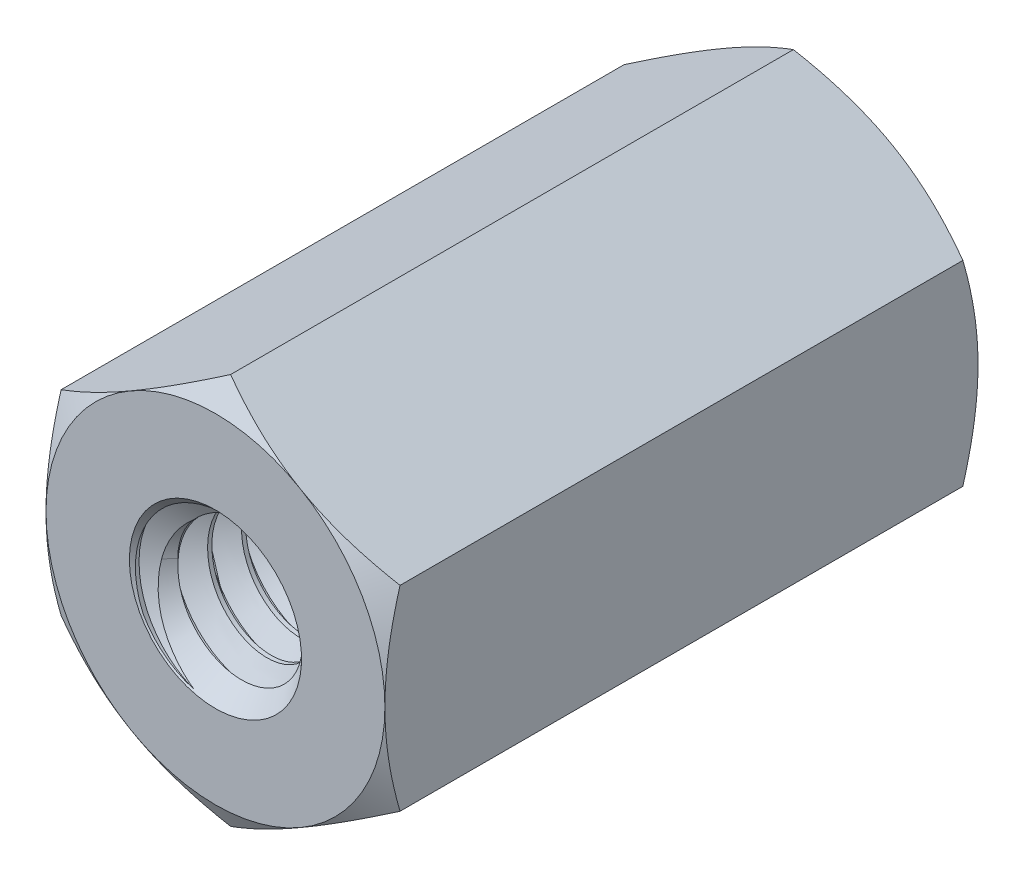
from build123d import *

# Parameters (mm, degrees)
EXTRUDE1_DEPTH          = 11.1125
EXTRUDE1_DEPTH_BACK     = 11.1125
SKETCH1_R               = 3.175
SWEEP1_PITCH            = 1.27
EXTRUDE2_DEPTH          = 26.41867433
SKETCH8_OUTSIDE_W       = 112.31
SKETCH8_OUTSIDE_H       = 114.274
SKETCH8_OUTSIDE_R       = 6.35
EXTRUDE4_DEPTH          = 26.41867433
EXTRUDE4_DRAFT          = -60
MIRROR1_COPY_1_SKETCH_W = 112.31
MIRROR1_COPY_1_SKETCH_H = 114.274
MIRROR1_COPY_1_SKETCH_R = 6.35
MIRROR1_COPY_1_DEPTH    = 26.41867433
MIRROR1_COPY_1_DRAFT    = -60


with BuildPart() as part:
    # Sketch1 → Extrude1 (new, two sides: drawn at the far end of the back side and taken through both)
    with BuildSketch(Plane.XY.offset(-EXTRUDE1_DEPTH_BACK)):
        Polygon((0, 7.332348419), (-6.35, 3.666174209), (-6.35, -3.666174209), (0, -7.332348419), (6.35, -3.666174209), (6.35, 3.666174209), align=None)
        Circle(SKETCH1_R, mode=Mode.SUBTRACT)
    extrude(amount=EXTRUDE1_DEPTH + EXTRUDE1_DEPTH_BACK)

    # Sweep1: the profile of Sketch12 profile screwed along a right-hand helix of 18.5 turns, 8 arcs to a turn; built about Z, then put on its axis
    sweep1_z = Axis((0, 0, 0), (0, 0, 1))
    sweep1_corners = [(3.1753, 0, -1.111423205), (3.1753, 0, 0.000173205), (2.350110803, 0, -0.47625), (2.350110803, 0, -0.635)]
    with BuildLine(mode=Mode.PRIVATE) as sweep1_profile:
        Line(sweep1_corners[0], sweep1_corners[1])
        Line(sweep1_corners[1], sweep1_corners[2])
        Line(sweep1_corners[2], sweep1_corners[3])
        Line(sweep1_corners[3], sweep1_corners[0])
    sweep1_cap = Face(sweep1_profile.wire())
    sweep1_turn_angles = [0, 22.5, 45, 67.5, 90, 112.5, 135, 157.5, 180, 202.5, 225, 247.5, 270, 292.5, 315, 337.5, 360]
    sweep1_turn_weights = [1, 0.9238795325112867, 1, 0.9238795325112867, 1, 0.9238795325112867, 1, 0.9238795325112867, 1, 0.9238795325112867, 1, 0.9238795325112867, 1, 0.9238795325112867, 1, 0.9238795325112867, 1]
    sweep1_turn_rails = [Edge.make_bspline([Vector(p[0], p[1], 0).rotate(sweep1_z, sweep1_turn_angles[k]) / sweep1_turn_weights[k] + Vector(0, 0, p[2] + SWEEP1_PITCH * sweep1_turn_angles[k] / 360) for k in range(17)], [0, 0, 0, 1, 1, 2, 2, 3, 3, 4, 4, 5, 5, 6, 6, 7, 7, 8, 8, 8], 2, sweep1_turn_weights) for p in sweep1_corners]
    sweep1_turn_sides = [Face.make_surface_from_curves(sweep1_turn_rails[p[0]], sweep1_turn_rails[p[1]]) for p in [(0, 1), (1, 2), (2, 3), (3, 0)]]
    sweep1_last_angles = [6480, 6502.5, 6525, 6547.5, 6570, 6592.5, 6615, 6637.5, 6660]
    sweep1_last_weights = [1, 0.9238795325112867, 1, 0.9238795325112867, 1, 0.9238795325112867, 1, 0.9238795325111926, 1]
    sweep1_last_rails = [Edge.make_bspline([Vector(p[0], p[1], 0).rotate(sweep1_z, sweep1_last_angles[k]) / sweep1_last_weights[k] + Vector(0, 0, p[2] + SWEEP1_PITCH * sweep1_last_angles[k] / 360) for k in range(9)], [0, 0, 0, 1, 1, 2, 2, 3, 3, 4, 4, 4], 2, sweep1_last_weights) for p in sweep1_corners]
    sweep1_last_sides = [Face.make_surface_from_curves(sweep1_last_rails[p[0]], sweep1_last_rails[p[1]]) for p in [(0, 1), (1, 2), (2, 3), (3, 0)]]
    sweep1 = Plane(origin=(0, 0, -11.1125), x_dir=(0, 1, 0), z_dir=(0, 0, 1)) * Solid(Shell([*[p.moved(Location((0, 0, SWEEP1_PITCH * i))) for i in range(18) for p in sweep1_turn_sides], *sweep1_last_sides, sweep1_cap, sweep1_cap.rotate(sweep1_z, 6660).moved(Location((0, 0, SWEEP1_PITCH * 6660 / 360)))]))
    add(sweep1)

    # Sketch6 → Extrude2 (cut, through all)
    with BuildSketch(Plane(origin=(0, 0, -11.1125), x_dir=(-1, 0, 0), z_dir=(0, 0, -1))):
        Polygon((0, 7.332348419), (-6.35, 3.666174209), (-6.35, -3.666174209), (0, -7.332348419), (6.35, -3.666174209), (6.35, 3.666174209), align=None)
    extrude2 = extrude(amount=EXTRUDE2_DEPTH, mode=Mode.SUBTRACT)

    # Extrude3 cone 1 section (through the dimple's axis) → Extrude3 (revolve, cut)
    with BuildSketch(Plane(origin=(0, 0, -11.1125), x_dir=(0, 1, 0), z_dir=(1, 0, 0))):
        Polygon((0, 0), (3.2258, 0), (0, 3.459246985), align=None)
    extrude3 = revolve(axis=Axis((0, 0, -11.1125), (0, 0, 1)), mode=Mode.SUBTRACT)


with BuildPart() as extrude4_tool:
    # Sketch8 outside → Extrude4 (with draft: the straight prism first)
    with BuildSketch(Plane(origin=(0, 0, -11.1125), x_dir=(-1, 0, 0), z_dir=(0, 0, -1))):
        Rectangle(SKETCH8_OUTSIDE_W, SKETCH8_OUTSIDE_H)
        Circle(SKETCH8_OUTSIDE_R, mode=Mode.SUBTRACT)
    extrude(amount=-EXTRUDE4_DEPTH)
    # Extrude4: the draft: its side faces are tilted about the plane it starts from
    extrude4_sides = [extrude4_tool.faces().sort_by_distance(p)[0] for p in [
        (0, -57.137, 2.096837165),
        (-56.155, 0, 2.096837165),
        (0, 57.137, 2.096837165),
        (56.155, 0, 2.096837165),
        (6.35, 0, 2.096837165),
    ]]
    draft(extrude4_sides, Plane(origin=(0, 0, -11.1125), x_dir=(-1, 0, 0), z_dir=(0, 0, -1)), EXTRUDE4_DRAFT)


with BuildPart() as part_1:
    add(part.part)

    # Extrude4: cut by extrude4_tool
    add(extrude4_tool.part, mode=Mode.SUBTRACT)

    # Mirror1: Extrude2, Extrude3 across plane
    add(extrude2.mirror(Plane.XY), mode=Mode.SUBTRACT)
    add(extrude3.mirror(Plane.XY), mode=Mode.SUBTRACT)


with BuildPart() as mirror1_copy_1_tool:
    # Mirror1 copy 1 sketch → Mirror1 copy 1 (with draft: the straight prism first)
    with BuildSketch(Plane(origin=(0, 0, 11.1125), x_dir=(-1, 0, 0), z_dir=(0, 0, 1))):
        Rectangle(MIRROR1_COPY_1_SKETCH_W, MIRROR1_COPY_1_SKETCH_H)
        Circle(MIRROR1_COPY_1_SKETCH_R, mode=Mode.SUBTRACT)
    extrude(amount=-MIRROR1_COPY_1_DEPTH)
    # Mirror1 copy 1: the draft: its side faces are tilted about the plane it starts from
    mirror1_copy_1_sides = [mirror1_copy_1_tool.faces().sort_by_distance(p)[0] for p in [
        (0, -57.137, -2.096837165),
        (-56.155, 0, -2.096837165),
        (0, 57.137, -2.096837165),
        (56.155, 0, -2.096837165),
        (6.35, 0, -2.096837165),
    ]]
    draft(mirror1_copy_1_sides, Plane(origin=(0, 0, 11.1125), x_dir=(-1, 0, 0), z_dir=(0, 0, 1)), MIRROR1_COPY_1_DRAFT)


with BuildPart() as part_2:
    add(part_1.part)

    # Mirror1 copy 1: cut by mirror1_copy_1_tool
    add(mirror1_copy_1_tool.part, mode=Mode.SUBTRACT)


solid = part_2.part
